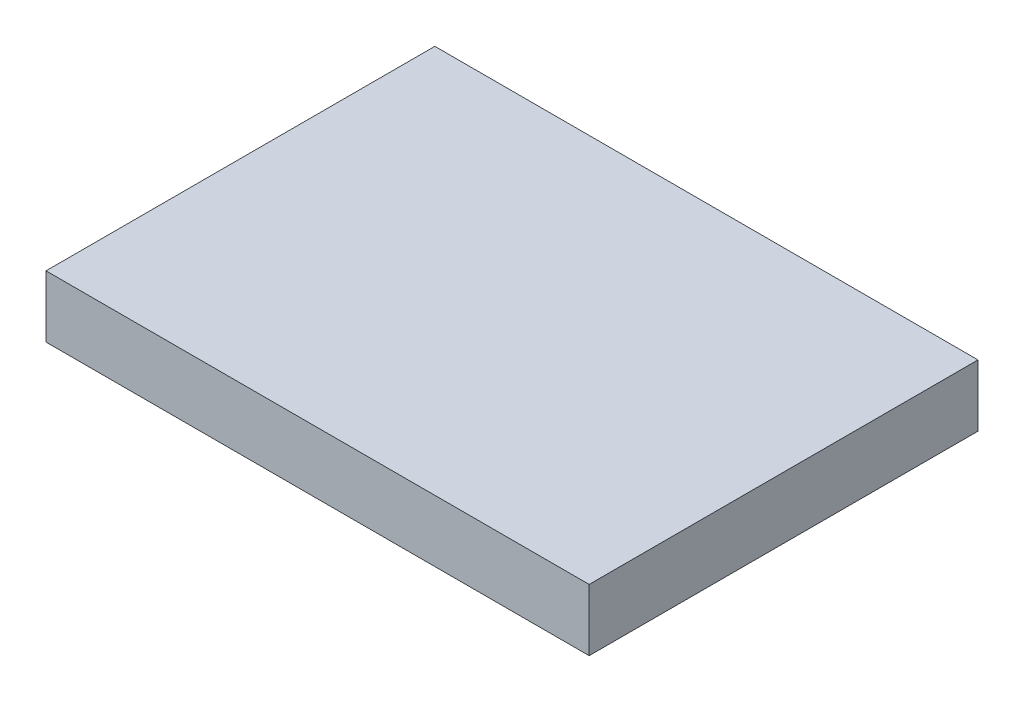
from build123d import *

# Parameters (mm, degrees)
SKETCH_1_W      = 88
SKETCH_1_H      = 63
EXTRUDE_1_DEPTH = 10


with BuildPart() as part:
    # 草图1 → 凸台-拉伸1 (new body)
    with BuildSketch(Plane(origin=(0, 0, 0), x_dir=(1, 0, 0), z_dir=(0, 1, 0))):
        Rectangle(SKETCH_1_W, SKETCH_1_H)
    extrude(amount=EXTRUDE_1_DEPTH)


solid = part.part
